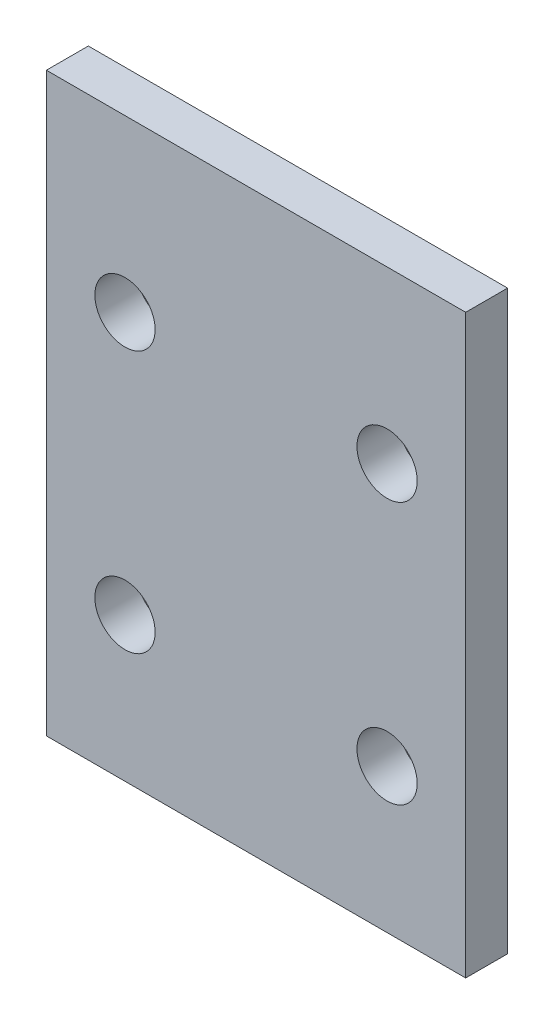
from build123d import *

# Parameters (mm, degrees)
SKETCH_1_W             = 160
SKETCH_1_H             = 220
SM_BASE_FLANGE_1_DEPTH = 16
SKETCH_2_R             = 11.5
CUT_EXTRUDE_1_DEPTH    = 30


# Sheet-metal steps are written as plain solids
with BuildPart() as part:
    # Sketch 1 → Базовая кромка1 (new body)
    with BuildSketch(Plane.XY):
        with Locations((80, -110)):
            Rectangle(SKETCH_1_W, SKETCH_1_H)
    extrude(amount=-SM_BASE_FLANGE_1_DEPTH)

    # Sketch 2 → Вырез-Вытянуть1 (cut)
    with BuildSketch(Plane(origin=(0, 0, -16), x_dir=(-1, 0, 0), z_dir=(0, 0, -1))):
        with Locations((-30, -165)):
            Circle(SKETCH_2_R)
        with Locations((-30, -65)):
            Circle(SKETCH_2_R)
        with Locations(Location((-130, -165, 0), (0, 0, 180))):
            Circle(SKETCH_2_R)
        with Locations(Location((-130, -65, 0), (0, 0, 180))):
            Circle(SKETCH_2_R)
    extrude(amount=-CUT_EXTRUDE_1_DEPTH, mode=Mode.SUBTRACT)


solid = part.part
